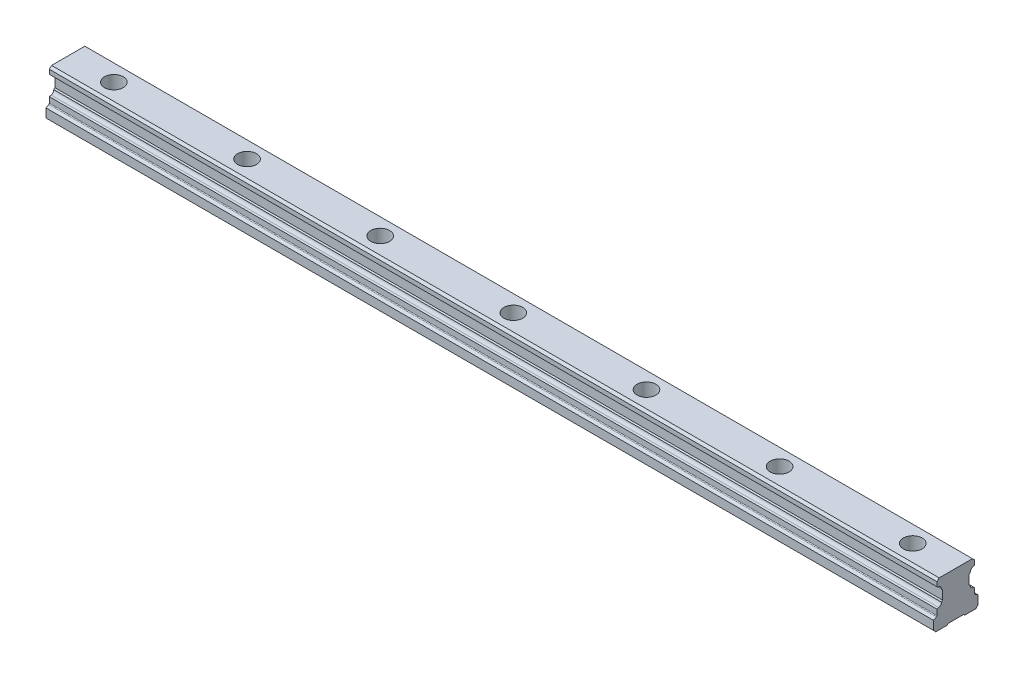
from build123d import *

# Parameters (mm, degrees)
BOSS_EXTRUDE5_DEPTH = 400
SKETCH8_R           = 4.25
CUT_EXTRUDE1_DEPTH  = 9
SKETCH9_R           = 3
CUT_EXTRUDE2_DEPTH  = 459.748231604
LPATTERN1_COUNT     = 20
LPATTERN1_PITCH     = 60


with BuildPart() as part:
    # Sketch7 → Boss-Extrude5 (new body)
    with BuildSketch(Plane(origin=(58.5, 0, 0), x_dir=(0, 0, -1), z_dir=(1, 0, 0))):
        with BuildLine():
            Line((-7.709038211, 8.883084864), (-8.5, 8.601077183))
            Line((-8.5, 8.601077183), (-8.5, 6.104700538))
            ThreePointArc((-8.5, 6.104700538), (-8.566987298, 5.854700538), (-8.75, 5.671687836))
            Line((-8.75, 5.671687836), (-10, 4.95))
            Line((-10, 4.95), (-10, 1))
            Line((-10, 1), (-9, 0))
            Line((-9, 0), (-4, 0))
            Line((-4, 0), (-3.5, 0.5))
            Line((-3.5, 0.5), (3.5, 0.5))
            Line((3.5, 0.5), (4, 0))
            Line((4, 0), (9, 0))
            Line((9, 0), (10, 1))
            Line((10, 1), (10, 4.95))
            Line((10, 4.95), (8.75, 5.671687836))
            ThreePointArc((8.75, 5.671687836), (8.566987298, 5.854700538), (8.5, 6.104700538))
            Line((8.5, 6.104700538), (8.5, 8.46691323))
            Line((8.5, 8.46691323), (8.084678947, 8.882234283))
            ThreePointArc((8.084678947, 8.882234283), (6.941822875, 9.249266637), (6.503340774, 10.366659226))
            Line((6.503340774, 10.366659226), (6, 10.87))
            Line((6, 10.87), (6, 14.93))
            Line((6, 14.93), (6.503340774, 15.433340774))
            ThreePointArc((6.503340774, 15.433340774), (6.813545517, 16.412959034), (7.709038211, 16.916915136))
            Line((7.709038211, 16.916915136), (8.5, 17.198922817))
            Line((8.5, 17.198922817), (8.5, 19.3))
            Line((8.5, 19.3), (7.5, 20.3))
            Line((7.5, 20.3), (-7.5, 20.3))
            Line((-7.5, 20.3), (-8.5, 19.3))
            Line((-8.5, 19.3), (-8.5, 17.33308677))
            Line((-8.5, 17.33308677), (-8.084678947, 16.917765717))
            ThreePointArc((-8.084678947, 16.917765717), (-6.941822875, 16.550733363), (-6.503340774, 15.433340774))
            Line((-6.503340774, 15.433340774), (-6, 14.93))
            Line((-6, 14.93), (-6, 10.87))
            Line((-6, 10.87), (-6.503340774, 10.366659226))
            ThreePointArc((-6.503340774, 10.366659226), (-6.813545517, 9.387040966), (-7.709038211, 8.883084864))
        make_face()
    extrude(amount=BOSS_EXTRUDE5_DEPTH)

    # Sketch8 → Cut-Extrude1 (cut)
    with BuildSketch(Plane(origin=(0, 20.3, 0), x_dir=(1, 0, 0), z_dir=(0, 1, 0))):
        with Locations((79.1, 0)):
            Circle(SKETCH8_R)
    cut_extrude1 = extrude(amount=-CUT_EXTRUDE1_DEPTH, mode=Mode.SUBTRACT)

    # Sketch9 → Cut-Extrude2 (cut, through all)
    with BuildSketch(Plane(origin=(0, 11.3, 0), x_dir=(1, 0, 0), z_dir=(0, 1, 0))):
        with Locations((79.1, 0)):
            Circle(SKETCH9_R)
    cut_extrude2 = extrude(amount=-CUT_EXTRUDE2_DEPTH, mode=Mode.SUBTRACT)

    # LPattern1: Cut-Extrude1, Cut-Extrude2 ×20
    with Locations(*[(i * LPATTERN1_PITCH, 0, 0) for i in range(1, LPATTERN1_COUNT)]):
        add(cut_extrude1, mode=Mode.SUBTRACT)
        add(cut_extrude2, mode=Mode.SUBTRACT)


solid = part.part
